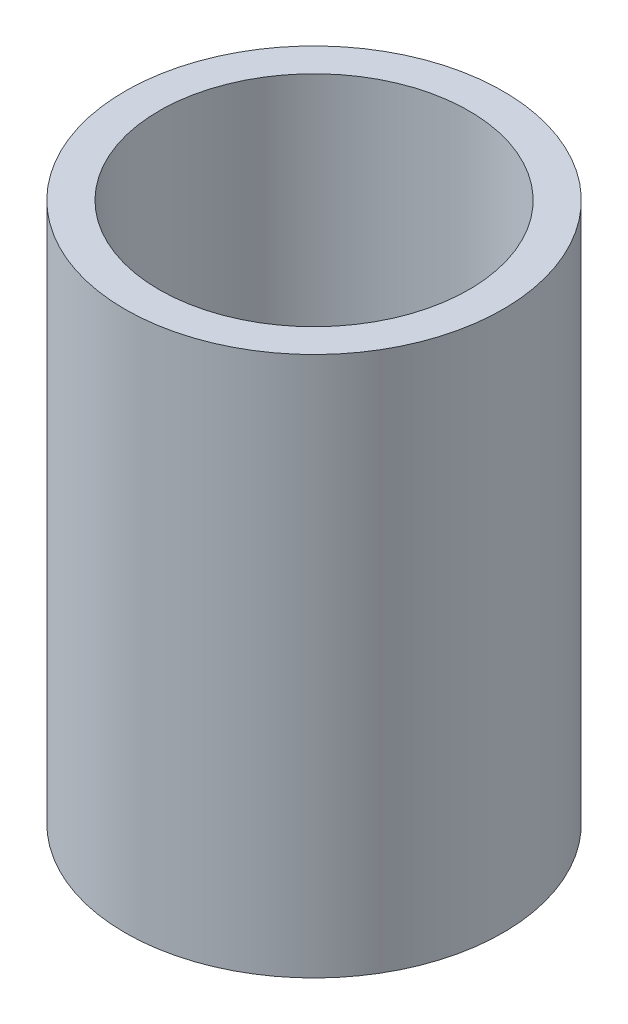
from build123d import *

# Parameters (mm, degrees)
SKETCH1_R           = 60
BOSS_EXTRUDE1_DEPTH = 171.422149729
SKETCH2_R           = 49.186952889
CUT_EXTRUDE1_DEPTH  = 192.273504223


with BuildPart() as part:
    # Sketch1 → Boss-Extrude1 (new body)
    with BuildSketch(Plane(origin=(0, 0, 0), x_dir=(1, 0, 0), z_dir=(0, 1, 0))):
        Circle(SKETCH1_R)
    extrude(amount=BOSS_EXTRUDE1_DEPTH)

    # Sketch2 → Cut-Extrude1 (cut, through all)
    with BuildSketch(Plane(origin=(0, 0, 0), x_dir=(1, 0, 0), z_dir=(0, 1, 0))):
        Circle(SKETCH2_R)
    extrude(amount=CUT_EXTRUDE1_DEPTH, mode=Mode.SUBTRACT)


solid = part.part
